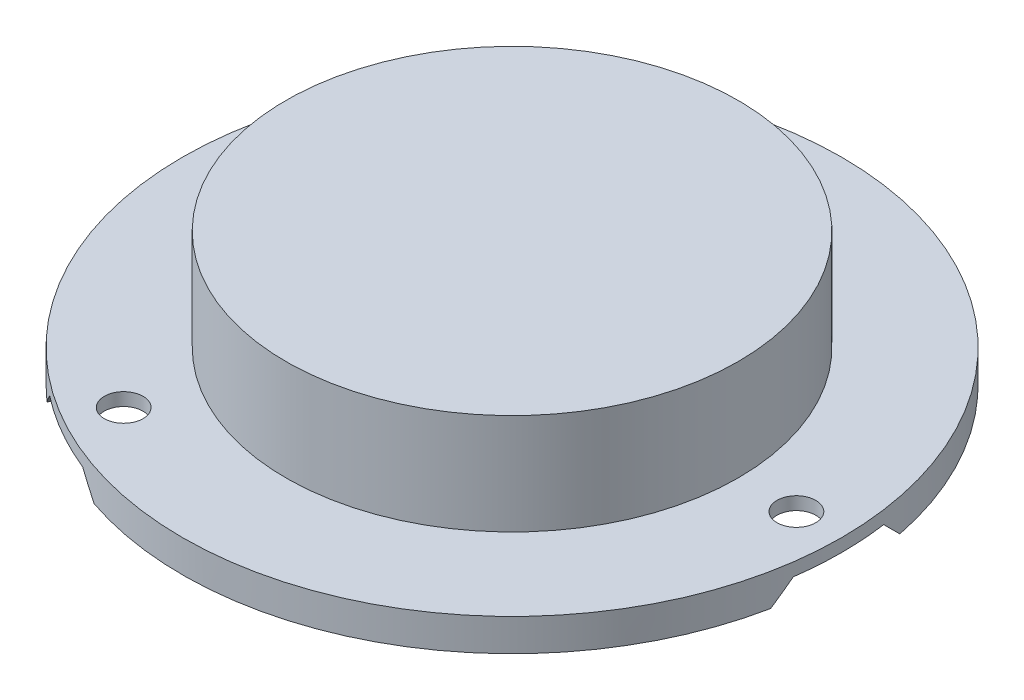
from build123d import *

# Parameters (mm, degrees)
F_3_0MM_DOWEL_HOLE1_D        = 3
CUT_EXTRUDE1_DEPTH           = 1.5
CHAMFER1_SIZE                = 1.5
CIRPATTERN1_COUNT            = 3
CHAMFER1_OF_CIRPATTERN1_SIZE = 1.5
CIRPATTERN2_COUNT            = 8


with BuildPart() as part:
    # Sketch1 → Revolve1 (revolve)
    with BuildSketch(Plane.XY):
        with BuildLine():
            Line((16, 0), (25.5, 0))
            Line((25.5, 0), (25.5, 2.5))
            Line((25.5, 2.5), (17.5, 2.5))
            Line((17.5, 2.5), (17.5, 10.3))
            Line((17.5, 10.3), (0, 10.3))
            Line((0, 10.3), (0, 2.5))
            Line((0, 2.5), (0, 0))
            Line((0, 0), (0, -0.8))
            Line((0, -0.8), (0, -6.4))
            Line((0, -6.4), (0, -8.4))
            ThreePointArc((0, -8.4), (0.530330086, -8.619669914), (0.75, -9.15))
            Line((0.75, -9.15), (2, -9.15))
            Line((2, -9.15), (2, -8.9))
            Line((2, -8.9), (7.5, -8.9))
            Line((7.5, -8.9), (7.5, -6.4))
            Line((7.5, -6.4), (12.5, -6.4))
            Line((12.5, -6.4), (12.5, -0.8))
            Line((12.5, -0.8), (16, -0.8))
            Line((16, -0.8), (16, 0))
        make_face()
    revolve(axis=Axis((0, 2.5, 0), (0, 1, 0)))

    # Ø3.0mm Dowel Hole1 (through all)
    with Locations(Plane(origin=(0, 0, 0), x_dir=(-1, 0, 0), z_dir=(0, -1, 0))):
        with Locations((-22, 0)):
            f_3_0mm_dowel_hole1 = Hole(F_3_0MM_DOWEL_HOLE1_D / 2)

    # Sketch5 → Cut-Extrude1 (cut)
    with BuildSketch(Plane.XZ):
        with BuildLine():
            Line((22, -3.5), (25.5, -3.5))
            Line((25.5, -3.5), (25.5, 3.5))
            Line((25.5, 3.5), (22, 3.5))
            ThreePointArc((22, 3.5), (18.5, 0), (22, -3.5))
        make_face()
    cut_extrude1 = extrude(amount=-CUT_EXTRUDE1_DEPTH, mode=Mode.SUBTRACT)

    # Chamfer1
    chamfer1_edges = [part.edges().sort_by_distance(p)[0] for p in [
        (23.62933094, 0, -3.5),
        (18.5, 0, 0),
        (23.62933094, 0, 3.5),
    ]]
    chamfer(chamfer1_edges, length=CHAMFER1_SIZE - 0.0001)  # a hair under: the kernel refuses the full size

    # CirPattern1: Ø3.0mm Dowel Hole1, Cut-Extrude1 ×3 about axis
    cirpattern1_axis = Axis((0, 0, 0), (0, 1, 0))
    add([f_3_0mm_dowel_hole1.rotate(cirpattern1_axis, i * 360 / CIRPATTERN1_COUNT) for i in range(1, CIRPATTERN1_COUNT)], mode=Mode.SUBTRACT)
    add([cut_extrude1.rotate(cirpattern1_axis, i * 360 / CIRPATTERN1_COUNT) for i in range(1, CIRPATTERN1_COUNT)], mode=Mode.SUBTRACT)

    # Chamfer1 of CirPattern1
    chamfer1_of_cirpattern1_edges = [part.edges().sort_by_distance(p)[0] for p in [
        (-14.845754383, 0, -18.713600869),
        (-9.25, 0, -16.02146997),
        (-8.783576557, 0, -22.213600869),
        (-8.783576557, 0, 22.213600869),
        (-9.25, 0, 16.02146997),
        (-14.845754383, 0, 18.713600869),
    ]]
    chamfer(chamfer1_of_cirpattern1_edges, length=CHAMFER1_OF_CIRPATTERN1_SIZE - 0.0001)  # a hair under: the kernel refuses the full size

    # Sketch7 → M2 Tapped Hole1 (revolve, cut)
    with BuildSketch(Plane(origin=(10, -6.4, 0), x_dir=(0, 0, -1), z_dir=(1, 0, 0))):
        Polygon((0, 0), (0, 5.480688495), (0.8, 5), (0.8, 0), align=None)
    m2_tapped_hole1 = revolve(axis=Axis((10, -12.75, 0), (0, 1, 0)), mode=Mode.SUBTRACT)

    # CirPattern2: M2 Tapped Hole1 ×8 about axis
    cirpattern2_axis = Axis((0, 0, 0), (0, 1, 0))
    for i in range(1, CIRPATTERN2_COUNT):
        add(m2_tapped_hole1.rotate(cirpattern2_axis, i * 360 / CIRPATTERN2_COUNT), mode=Mode.SUBTRACT)


solid = part.part
